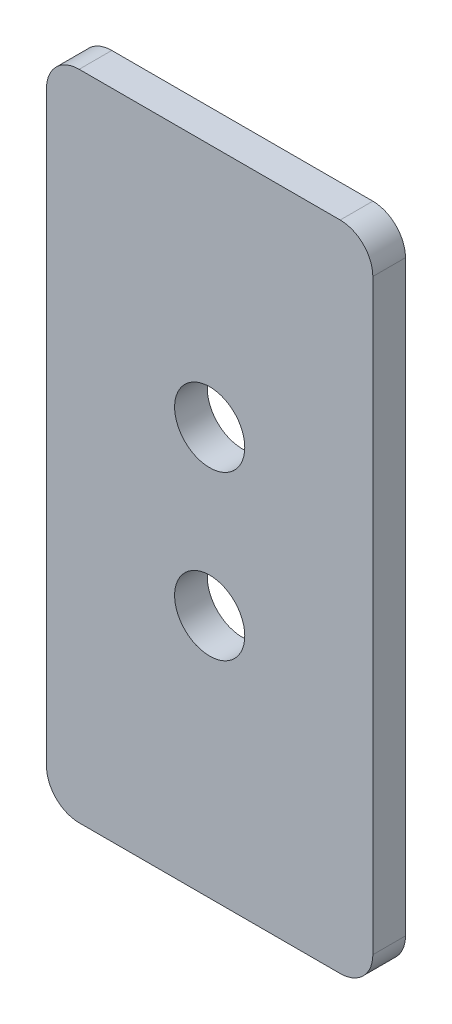
from build123d import *

# Parameters (mm, degrees)
SKETCH1_W           = 20
SKETCH1_H           = 40
SKETCH1_R           = 2.15
BOSS_EXTRUDE1_DEPTH = 2
FILLET1_R           = 2


with BuildPart() as part:
    # Sketch1 → Boss-Extrude1 (new body)
    with BuildSketch(Plane.XY):
        Rectangle(SKETCH1_W, SKETCH1_H)
        with Locations((0, -5)):
            Circle(SKETCH1_R, mode=Mode.SUBTRACT)
        with Locations((0, 5)):
            Circle(SKETCH1_R, mode=Mode.SUBTRACT)
    extrude(amount=BOSS_EXTRUDE1_DEPTH)

    # Fillet1
    fillet1_edges = [part.edges().sort_by_distance(p)[0] for p in [
        (-10, 20, 1),
        (10, 20, 1),
        (-10, -20, 1),
        (10, -20, 1),
    ]]
    fillet(fillet1_edges, radius=FILLET1_R)


solid = part.part
